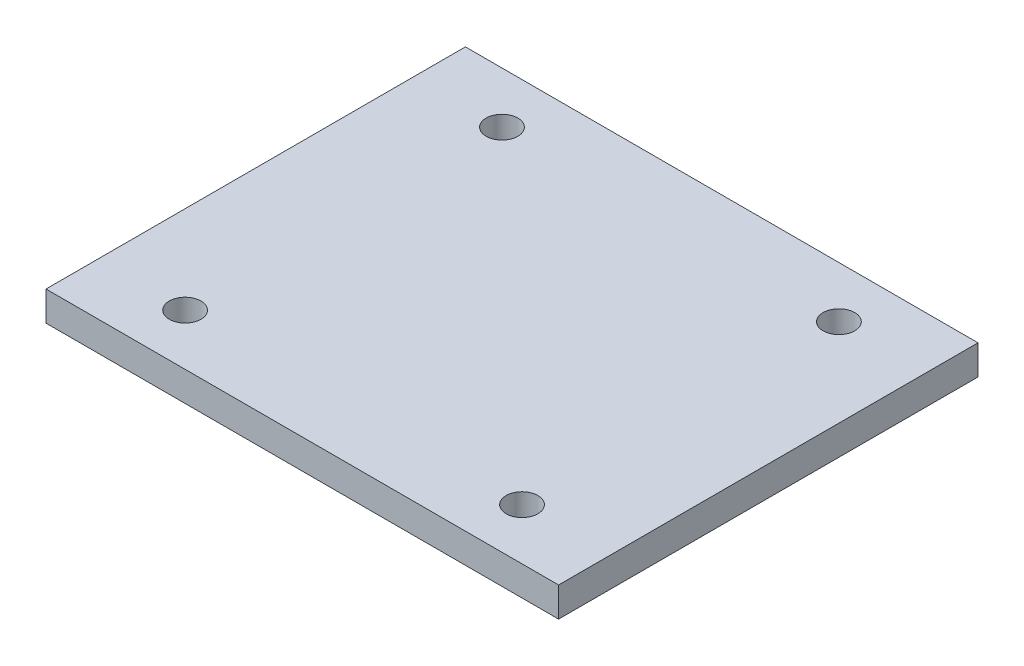
from build123d import *

# Parameters (mm, degrees)
SKETCH2_W            = 110
SKETCH2_H            = 90
BOSS_EXTRUDE1_DEPTH  = 6.35
SKETCH3_R            = 3.4
MOUNTING_HOLES_DEPTH = 143.268487375


with BuildPart() as part:
    # Sketch2 → Boss-Extrude1 (new body)
    with BuildSketch(Plane(origin=(0, 0, 0), x_dir=(1, 0, 0), z_dir=(0, 1, 0))):
        with Locations((55, 45)):
            Rectangle(SKETCH2_W, SKETCH2_H)
    extrude(amount=BOSS_EXTRUDE1_DEPTH)

    # Sketch3 → Mounting Holes (cut, through all)
    with BuildSketch(Plane(origin=(0, 6.35, 0), x_dir=(1, 0, 0), z_dir=(0, 1, 0))):
        with Locations((18.85, 79)):
            Circle(SKETCH3_R)
        with Locations((18.85, 11)):
            Circle(SKETCH3_R)
        with Locations((91.15, 11)):
            Circle(SKETCH3_R)
        with Locations((91.15, 79)):
            Circle(SKETCH3_R)
    extrude(amount=-MOUNTING_HOLES_DEPTH, mode=Mode.SUBTRACT)


solid = part.part
